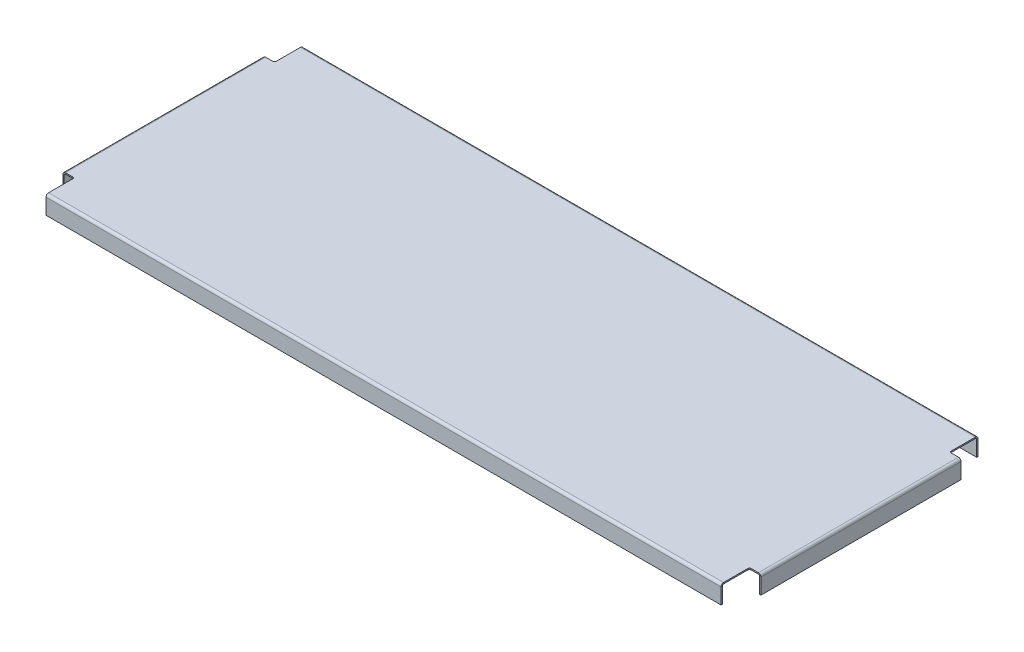
from build123d import *

# Parameters (mm, degrees)
SM_BASE_FLANGE_1_DEPTH           = 410
CUT_EXTRUDE_1_DEPTH              = 438.623696799
SM_EDGE_FLANGE_1_STRIP_W         = 9
SM_EDGE_FLANGE_1_STRIP_H         = 1.5
SM_EDGE_FLANGE_1_STRIP_CUT_DEPTH = 118
SM_EDGE_FLANGE_1_DEPTH           = 118


# Sheet-metal steps are written as plain solids
with BuildPart() as part:
    # Sketch 1 → Базовая кромка1 (new body)
    with BuildSketch(Plane(origin=(0, 0, 0), x_dir=(0, 0, -1), z_dir=(1, 0, 0))):
        with BuildLine():
            Line((0, 0), (-148.5, 0))
            ThreePointArc((-148.5, 0), (-149.560660172, -0.439339828), (-150, -1.5))
            Line((-150, -1.5), (-150, -20))
            Line((-150, -20), (-151.5, -20))
            Line((-151.5, -20), (-151.5, -1.5))
            ThreePointArc((-151.5, -1.5), (-150.621320344, 0.621320344), (-148.5, 1.5))
            Line((-148.5, 1.5), (0, 1.5))
            Line((0, 1.5), (0, 0))
        make_face()
    extrude(amount=-SM_BASE_FLANGE_1_DEPTH)

    # Эскиз9 → Вырез-Вытянуть1 (cut, through all)
    with BuildSketch(Plane(origin=(0, 1.5, 0), x_dir=(1, 0, 0), z_dir=(0, 1, 0))):
        with BuildLine():
            Line((-410, -118), (-400, -118))
            ThreePointArc((-400, -118), (-398.585786438, -118.585786438), (-398, -120))
            Line((-398, -120), (-398, -151.5))
            Line((-398, -151.5), (-410, -151.5))
            Line((-410, -151.5), (-410, -118))
        make_face()
    extrude(amount=-CUT_EXTRUDE_1_DEPTH, mode=Mode.SUBTRACT)

    # Ребро-кромка1 strip (across the edge) → Ребро-кромка1 strip cut (cut)
    with BuildSketch(Plane(origin=(-410, 0, 118), x_dir=(1, 0, 0), z_dir=(0, 0, -1))):
        with Locations((-3, -0.75)):
            Rectangle(SM_EDGE_FLANGE_1_STRIP_W, SM_EDGE_FLANGE_1_STRIP_H)
    extrude(amount=SM_EDGE_FLANGE_1_STRIP_CUT_DEPTH, mode=Mode.SUBTRACT)

    # Ребро-кромка1 section (across the edge) → Ребро-кромка1 (add)
    with BuildSketch(Plane(origin=(-410, 0, 118), x_dir=(1, 0, 0), z_dir=(0, 0, -1))):
        with BuildLine():
            Line((-1.5, 1.5), (-1.5, 20))
            Line((-1.5, 20), (0, 20))
            Line((0, 20), (0, 1.5))
            ThreePointArc((0, 1.5), (0.439339828, 0.439339828), (1.5, 0))
            Line((1.5, 0), (1.5, -1.5))
            ThreePointArc((1.5, -1.5), (-0.621320344, -0.621320344), (-1.5, 1.5))
        make_face()
    extrude(amount=SM_EDGE_FLANGE_1_DEPTH)

    # Зеркальное отражение1: part across plane


with BuildPart() as part_1:
    add(part.part)
    add(part.part.mirror(Plane(origin=(-568.017972801, 1.5, 0), x_dir=(1, 0, 0), z_dir=(0, 0, 1))))

    # Зеркальное отражение2: part across plane


with BuildPart() as part_2:
    add(part_1.part)
    add(part_1.part.mirror(Plane(origin=(0, 1.5, 148.5), x_dir=(0, 0, 1), z_dir=(1, 0, 0))))


solid = part_2.part
